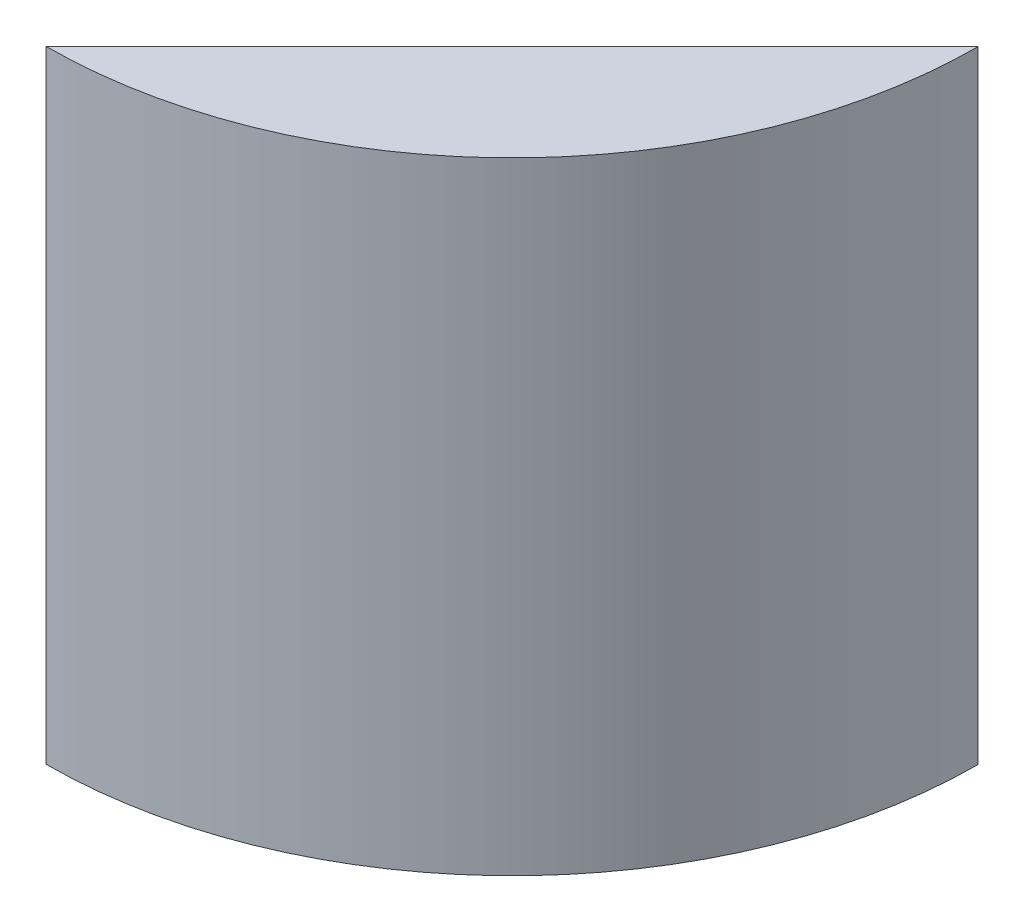
from build123d import *

# Parameters (mm, degrees)
SKETCH1_R           = 85.725
BOSS_EXTRUDE1_DEPTH = 114.3
CUT_EXTRUDE1_DEPTH  = 152.4
SKETCH3_R           = 2.778125
CUT_EXTRUDE2_DEPTH  = 12.7
SKETCH4_R           = 6.985
CUT_EXTRUDE3_DEPTH  = 6.096


with BuildPart() as part:
    # Sketch1 → Boss-Extrude1 (new body)
    with BuildSketch(Plane(origin=(0, 0, 0), x_dir=(1, 0, 0), z_dir=(0, 1, 0))):
        Circle(SKETCH1_R)
    extrude(amount=BOSS_EXTRUDE1_DEPTH)

    # Sketch2 → Cut-Extrude1 (cut)
    with BuildSketch(Plane(origin=(0, 114.3, 0), x_dir=(1, 0, 0), z_dir=(0, 1, 0))):
        Polygon((85.724933621, -0.10668), (0, -85.725), (-45.627504124, -96.719379999), (-137.428949547, 46.173941299), (19.12530113, 101.910533163), (109.833872203, 30.600481808), align=None)
    extrude(amount=-CUT_EXTRUDE1_DEPTH, mode=Mode.SUBTRACT)

    # Sketch3 → Cut-Extrude2 (cut)
    with BuildSketch(Plane(origin=(42.862466811, 0, 42.91584), x_dir=(-0.7075466219424854, 0, 0.7066666666666667), z_dir=(-0.7066666666666667, 0, -0.7075466219424854))):
        with Locations((-37.719, 87.122)):
            Circle(SKETCH3_R)
        with Locations((-14.859, 87.122)):
            Circle(SKETCH3_R)
        with Locations((-37.719, 29.21)):
            Circle(SKETCH3_R)
        with Locations((-14.859, 29.21)):
            Circle(SKETCH3_R)
    extrude(amount=-CUT_EXTRUDE2_DEPTH, mode=Mode.SUBTRACT)

    # Sketch4 → Cut-Extrude3 (cut)
    with BuildSketch(Plane(origin=(0, 0, 0), x_dir=(-1, 0, 0), z_dir=(0, -1, 0))):
        with Locations((-51.720733405, -51.785137083)):
            Circle(SKETCH4_R)
    extrude(amount=-CUT_EXTRUDE3_DEPTH, mode=Mode.SUBTRACT)


solid = part.part
